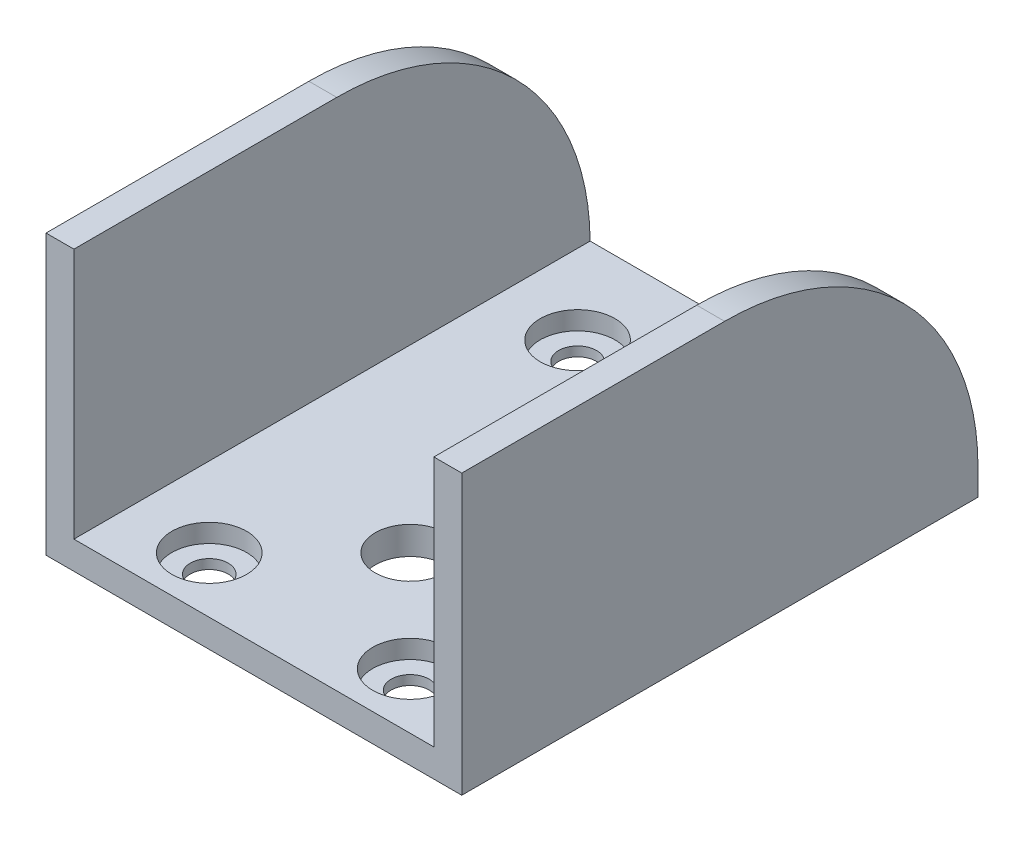
from build123d import *

# Parameters (mm, degrees)
SKETCH12_W                      = 32.25
SKETCH12_H                      = 46.25
BOSS_EXTRUDE2_DEPTH             = 2.5
CBORE_FOR_M3_SBHCS1_D           = 3.4
CBORE_FOR_M3_SBHCS1_CBORE_D     = 6.7
CBORE_FOR_M3_SBHCS1_CBORE_DEPTH = 1.65
F_6_0MM_DOWEL_HOLE1_D           = 6.25
SKETCH20_W                      = 46.25
SKETCH20_H                      = 25
BOSS_EXTRUDE3_DEPTH             = 2.5
FILLET1_R                       = 22.7


with BuildPart() as part:
    # Sketch12 → Boss-Extrude2 (new body)
    with BuildSketch(Plane(origin=(0, 0, 0), x_dir=(1, 0, 0), z_dir=(0, 1, 0))):
        Rectangle(SKETCH12_W, SKETCH12_H)
    extrude(amount=BOSS_EXTRUDE2_DEPTH)

    # CBORE for M3 SBHCS1 (through all)
    with Locations(Plane(origin=(0, 2.5, 0), x_dir=(1, 0, 0), z_dir=(0, 1, 0))):
        with Locations((-9, 14.875), (9, 14.875), (9, -18.125), (-9, -18.125)):
            CounterBoreHole(CBORE_FOR_M3_SBHCS1_D / 2, CBORE_FOR_M3_SBHCS1_CBORE_D / 2, CBORE_FOR_M3_SBHCS1_CBORE_DEPTH)

    # Ø6.0mm Dowel Hole1 (through all)
    with Locations(Plane(origin=(0, 2.5, 0), x_dir=(1, 0, 0), z_dir=(0, 1, 0))):
        with Locations((0, -9.125)):
            Hole(F_6_0MM_DOWEL_HOLE1_D / 2)

    # Sketch20 → Boss-Extrude3 (add)
    with BuildSketch(Plane.ZY.offset(16.125)):
        with Locations((0, 12.5)):
            Rectangle(SKETCH20_W, SKETCH20_H)
    boss_extrude3 = extrude(amount=BOSS_EXTRUDE3_DEPTH)

    # Mirror1: Boss-Extrude3 across plane
    add(boss_extrude3.mirror(Plane.ZY))

    # Fillet1
    fillet1_edges = [part.edges().sort_by_distance(p)[0] for p in [
        (-17.375, 25, -23.125),
    ]]
    fillet(fillet1_edges, radius=FILLET1_R)


solid = part.part
